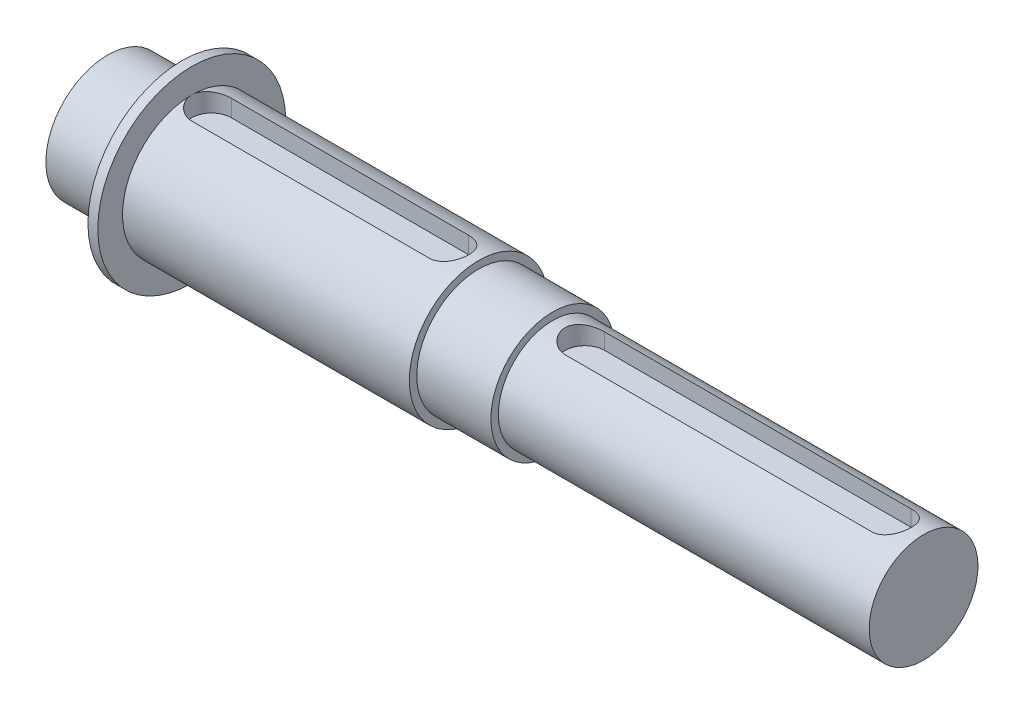
from build123d import *

# Parameters (mm, degrees)
CUT_EXTRUDE_START   = 10
CUT_EXTRUDE_1_DEPTH = 158.173562503
CUT_EXTRUDE_START_2 = 7
CUT_EXTRUDE_2_DEPTH = 161.173562503


with BuildPart() as part:
    # Эскиз1 → Повернуть1 (revolve)
    with BuildSketch(Plane.XY):
        Polygon((0, 0), (0, 12.5), (15, 12.5), (15, 14), (15, 19), (17, 19), (17, 14), (75, 14), (75, 12.5), (90, 12.5), (90, 11), (165, 11), (165, 0), align=None)
    revolve(axis=Axis((165, 0, 0), (-1, 0, 0)))

    # Эскиз2 → Вырез-Вытянуть1 (cut, through all)
    with BuildSketch(Plane(origin=(0, 0, 0), x_dir=(1, 0, 0), z_dir=(0, 1, 0)).offset(CUT_EXTRUDE_START)):
        with BuildLine():
            Line((21, 4), (69, 4))
            ThreePointArc((69, 4), (73, 0), (69, -4))
            Line((69, -4), (21, -4))
            ThreePointArc((21, -4), (17, 0), (21, 4))
        make_face()
    extrude(amount=CUT_EXTRUDE_1_DEPTH, mode=Mode.SUBTRACT)

    # Эскиз3 → Вырез-Вытянуть2 (cut, through all)
    with BuildSketch(Plane(origin=(0, 0, 0), x_dir=(1, 0, 0), z_dir=(0, 1, 0)).offset(CUT_EXTRUDE_START_2)):
        with BuildLine():
            Line((96.5, 4), (158.5, 4))
            ThreePointArc((158.5, 4), (162.5, 0), (158.5, -4))
            Line((158.5, -4), (96.5, -4))
            ThreePointArc((96.5, -4), (92.5, 0), (96.5, 4))
        make_face()
    extrude(amount=CUT_EXTRUDE_2_DEPTH, mode=Mode.SUBTRACT)


solid = part.part
